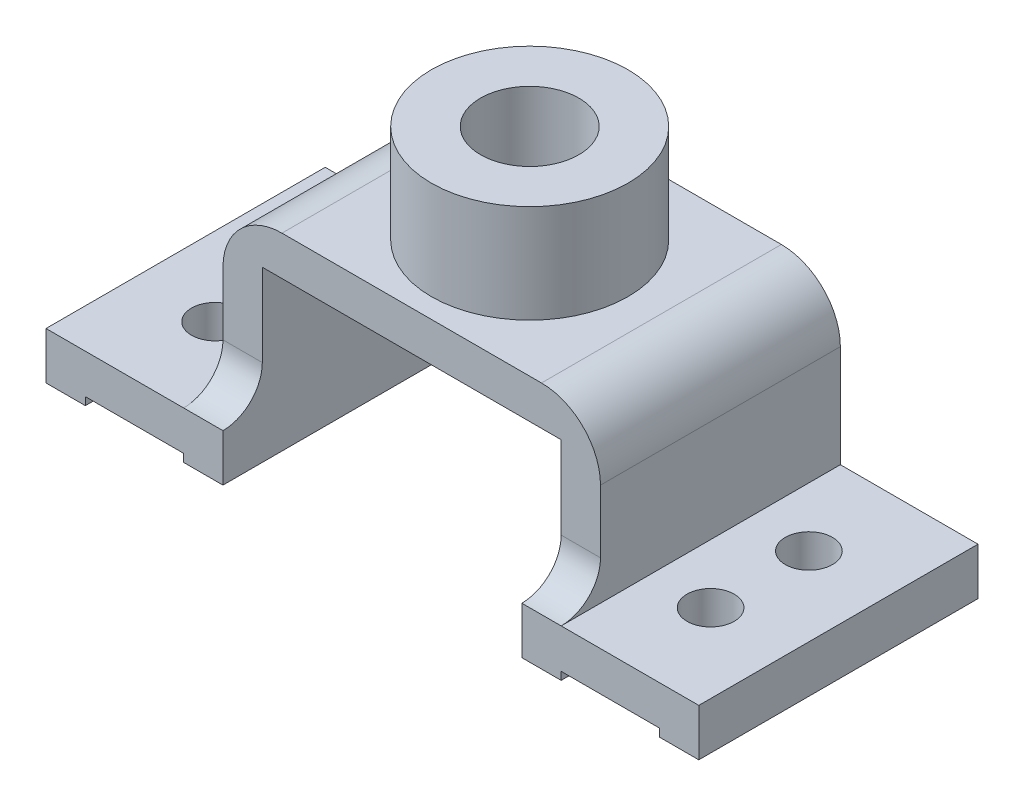
from build123d import *

# Parameters (mm, degrees)
BOSS_EXTRUDE1_DEPTH    = 71
BOSS_EXTRUDE1_2_DEPTH  = 71
BOSS_EXTRUDE3_DEPTH    = 61
FILLET2_R              = 10
FILLET3_R              = 15
SKETCH6_R              = 25
SKETCH6_R_2            = 12.5
BOSS_EXTRUDE4_DEPTH    = 25
F_12_0MM_DOWEL_SLOT1_D = 12
F_12_0MM_DOWEL_SLOT2_D = 12


with BuildPart() as part:
    # Sketch2 → Boss-Extrude1 (new body)
    with BuildSketch(Plane.XY):
        Polygon((-43.047651623, -3.53558301), (-33.047651623, -3.53558301), (-33.047651623, -1.53558301), (-8.047651623, -1.53558301), (-8.047651623, -3.53558301), (1.952348377, -3.53558301), (1.952348377, 8.46441699), (-43.047651623, 8.46441699), align=None)
    extrude(amount=-BOSS_EXTRUDE1_DEPTH)



with BuildPart() as body_2:
    # Sketch2 → Boss-Extrude1 2 (new body)
    with BuildSketch(Plane.XY):
        Polygon((77.952348377, -3.53558301), (77.952348377, 8.46441699), (122.952348377, 8.46441699), (122.952348377, -3.53558301), (112.952348377, -3.53558301), (112.952348377, -1.53558301), (87.952348377, -1.53558301), (87.952348377, -3.53558301), align=None)
    extrude(amount=-BOSS_EXTRUDE1_2_DEPTH)


with BuildPart() as part_1:
    add(part.part)

    add(body_2.part)  # Boss-Extrude3 merges body 2
    # Sketch5 → Boss-Extrude3 (add)
    with BuildSketch(Plane.XY.offset(-10)):
        Polygon((1.952348377, 8.46441699), (1.952348377, 39.46441699), (77.952348377, 39.46441699), (77.952348377, 8.46441699), (87.952348377, 8.46441699), (87.952348377, 49.46441699), (-8.047651623, 49.46441699), (-8.047651623, 8.46441699), align=None)
    extrude(amount=-BOSS_EXTRUDE3_DEPTH)

    # Fillet2
    fillet2_edges = [part_1.edges().sort_by_distance(p)[0] for p in [
        (82.952348377, 8.46441699, -10),
        (-3.047651623, 8.46441699, -10),
    ]]
    fillet(fillet2_edges, radius=FILLET2_R - 0.0001)  # a hair under: the kernel refuses the full size

    # Fillet3
    fillet3_edges = [part_1.edges().sort_by_distance(p)[0] for p in [
        (-8.047651623, 49.46441699, -40.5),
        (87.952348377, 49.46441699, -40.5),
    ]]
    fillet(fillet3_edges, radius=FILLET3_R)

    # Sketch6 → Boss-Extrude4 (add)
    with BuildSketch(Plane(origin=(0, 49.46441699, 0), x_dir=(1, 0, 0), z_dir=(0, 1, 0))):
        with Locations(Location((39.952348377, 40, 0), (0, 0, 180))):
            Circle(SKETCH6_R)
        with Locations(Location((39.952348377, 40, 0), (0, 0, 180))):
            Circle(SKETCH6_R_2, mode=Mode.SUBTRACT)
    extrude(amount=BOSS_EXTRUDE4_DEPTH)

    # Ø12.0mm Dowel Slot1 (through all)
    with Locations(Plane(origin=(0, 8.46441699, 0), x_dir=(1, 0, 0), z_dir=(0, 1, 0))):
        with Locations((102.952348377, 48), (102.952348377, 23)):
            Hole(F_12_0MM_DOWEL_SLOT1_D / 2)

    # Ø12.0mm Dowel Slot2 (through all)
    with Locations(Plane(origin=(0, 8.46441699, 0), x_dir=(1, 0, 0), z_dir=(0, 1, 0))):
        with Locations((-23.047651623, 23), (-23.047651623, 48)):
            Hole(F_12_0MM_DOWEL_SLOT2_D / 2)


solid = part_1.part
